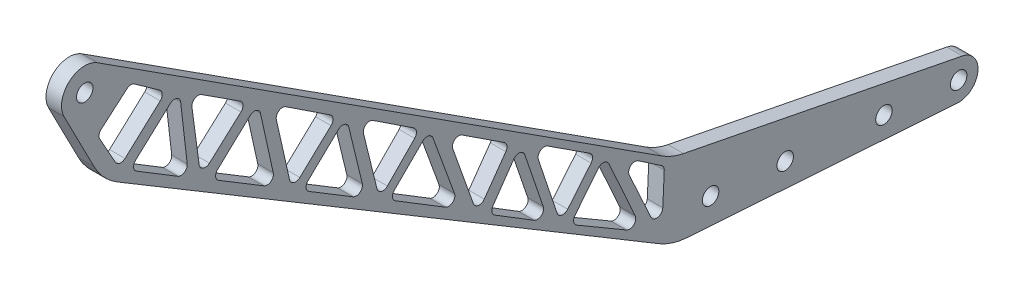
from build123d import *

# Parameters (mm, degrees)
SKETCH1_R           = 3.3782
BOSS_EXTRUDE1_DEPTH = 3.175
FILLET1_R           = 25.4
CUT_EXTRUDE3_DEPTH  = 1228.011230878


with BuildPart() as part:
    # Sketch1 → Boss-Extrude1 (new, symmetric)
    with BuildSketch(Plane(origin=(-76.913317281, 0, 0), x_dir=(0, 0, -1), z_dir=(1, 0, 0))):
        with BuildLine():
            Line((535.218804975, 907.961983625), (418.2911251, 916.04381761))
            Line((418.2911251, 916.04381761), (184.951401043, 1055.750632131))
            Line((184.951401043, 1055.750632131), (169.332572934, 1086.068584812))
            ThreePointArc((169.332572934, 1086.068584812), (171.394960666, 1097.480629658), (182.951934738, 1098.442170633))
            Line((182.951934738, 1098.442170633), (418.2911251, 947.10209485))
            Line((418.2911251, 947.10209485), (537.29962452, 923.668549005))
            ThreePointArc((537.29962452, 923.668549005), (543.634872549, 914.838132707), (535.218804975, 907.961983625))
        make_face()
        with Locations((177.8, 1090.430729224)):
            Circle(SKETCH1_R, mode=Mode.SUBTRACT)
        with Locations((434.1661251, 925.56881761)):
            Circle(SKETCH1_R, mode=Mode.SUBTRACT)
        with Locations((535.7661251, 915.880591264)):
            Circle(SKETCH1_R, mode=Mode.SUBTRACT)
        with Locations((464.714426144, 922.655836753)):
            Circle(SKETCH1_R, mode=Mode.SUBTRACT)
        with Locations((505.170909535, 918.798045727)):
            Circle(SKETCH1_R, mode=Mode.SUBTRACT)
    extrude(amount=BOSS_EXTRUDE1_DEPTH, both=True)

    # Fillet1
    fillet1_edges = [part.edges().sort_by_distance(p)[0] for p in [
        (-76.913317281, 1055.750632131, -184.951401043),
        (-76.913317281, 947.10209485, -418.2911251),
        (-76.913317281, 916.04381761, -418.2911251),
    ]]
    fillet(fillet1_edges, radius=FILLET1_R)

    # Sketch2 → Cut-Extrude3 (cut, through all)
    with BuildSketch(Plane(origin=(-73.738317281, 0, 0), x_dir=(0, 0, -1), z_dir=(1, 0, 0))):
        with BuildLine():
            Line((212.829527262, 1069.041008654), (198.606049634, 1055.993377244))
            ThreePointArc((198.606049634, 1055.993377244), (197.795300031, 1053.872622167), (199.004269659, 1051.950823673))
            Line((199.004269659, 1051.950823673), (215.926269112, 1041.670444047))
            ThreePointArc((215.926269112, 1041.670444047), (218.615766996, 1041.702840334), (219.768239325, 1044.133119314))
            Line((219.768239325, 1044.133119314), (217.069717501, 1067.461130351))
            ThreePointArc((217.069717501, 1067.461130351), (215.433378305, 1069.549408202), (212.829527262, 1069.041008654))
        make_face()
        with BuildLine():
            Line((221.707673579, 1063.343418403), (224.650059998, 1041.397601628))
            ThreePointArc((224.650059998, 1041.397601628), (226.295455268, 1039.349533682), (228.873798055, 1039.853573743))
            Line((228.873798055, 1039.853573743), (241.787421721, 1051.564110485))
            ThreePointArc((241.787421721, 1051.564110485), (242.612688612, 1053.652910015), (241.458691259, 1055.579679079))
            Line((241.458691259, 1055.579679079), (225.602681174, 1065.814959112))
            ThreePointArc((225.602681174, 1065.814959112), (222.864267326, 1065.825618016), (221.707673579, 1063.343418403))
        make_face()
        with BuildLine():
            Line((249.760451588, 1047.10749846), (255.013087704, 1023.356955829))
            ThreePointArc((255.013087704, 1023.356955829), (254.013265485, 1020.744378563), (251.218034235, 1020.635352414))
            Line((251.218034235, 1020.635352414), (232.626725119, 1031.885207079))
            ThreePointArc((232.626725119, 1031.885207079), (231.415536776, 1033.793616649), (232.204814978, 1035.911645028))
            Line((232.204814978, 1035.911645028), (245.543487979, 1048.412332994))
            ThreePointArc((245.543487979, 1048.412332994), (248.031197276, 1048.985502953), (249.760451588, 1047.10749846))
        make_face()
        with BuildLine():
            Line((256.288700965, 1041.549552348), (261.699227336, 1017.532223082))
            ThreePointArc((261.699227336, 1017.532223082), (263.433970562, 1015.661584361), (265.918441333, 1016.241263821))
            Line((265.918441333, 1016.241263821), (278.68191244, 1028.260261394))
            ThreePointArc((278.68191244, 1028.260261394), (279.471228845, 1030.327426074), (278.340023722, 1032.229152966))
            Line((278.340023722, 1032.229152966), (260.166026244, 1044.227484659))
            ThreePointArc((260.166026244, 1044.227484659), (257.323131811, 1044.197737851), (256.288700965, 1041.549552348))
        make_face()
        with BuildLine():
            Line((285.950762569, 1024.127747845), (291.489074391, 1001.273962422))
            ThreePointArc((291.489074391, 1001.273962422), (290.521120532, 998.626397343), (287.704860772, 998.503042243))
            Line((287.704860772, 998.503042243), (269.68827306, 1009.412873607))
            ThreePointArc((269.68827306, 1009.412873607), (268.479155554, 1011.307952053), (269.247601949, 1013.420480774))
            Line((269.247601949, 1013.420480774), (281.725877839, 1025.364434832))
            ThreePointArc((281.725877839, 1025.364434832), (284.195768621, 1025.967239758), (285.950762569, 1024.127747845))
        make_face()
        with BuildLine():
            Line((291.987661771, 1018.793447787), (297.503537578, 996.444310029))
            ThreePointArc((297.503537578, 996.444310029), (299.299237091, 994.60297465), (301.782224152, 995.273666815))
            Line((301.782224152, 995.273666815), (312.933934335, 1006.634819154))
            ThreePointArc((312.933934335, 1006.634819154), (313.6470155, 1008.682638254), (312.519272923, 1010.53473018))
            Line((312.519272923, 1010.53473018), (295.851686933, 1021.522715599))
            ThreePointArc((295.851686933, 1021.522715599), (292.988274637, 1021.476732768), (291.987661771, 1018.793447787))
        make_face()
        with BuildLine():
            Line((320.43174526, 1003.042647499), (329.235265326, 978.936149714))
            ThreePointArc((329.235265326, 978.936149714), (328.4584938, 976.099552316), (325.524390369, 975.89782016))
            Line((325.524390369, 975.89782016), (305.073021534, 988.402510218))
            ThreePointArc((305.073021534, 988.402510218), (303.875475207, 990.272233251), (304.605525107, 992.36913777))
            Line((304.605525107, 992.36913777), (316.253373877, 1003.970945497))
            ThreePointArc((316.253373877, 1003.970945497), (318.596738762, 1004.650885005), (320.43174526, 1003.042647499))
        make_face()
        with BuildLine():
            Line((328.561260154, 995.121856848), (337.000941843, 971.414023738))
            ThreePointArc((337.000941843, 971.414023738), (339.045281299, 969.749894674), (341.465034537, 970.795573217))
            Line((341.465034537, 970.795573217), (350.288338122, 983.224922615))
            ThreePointArc((350.288338122, 983.224922615), (350.712684232, 985.168376168), (349.606394049, 986.821616429))
            Line((349.606394049, 986.821616429), (332.343408774, 998.100100142))
            ThreePointArc((332.343408774, 998.100100142), (329.382755058, 997.969265202), (328.561260154, 995.121856848))
        make_face()
        with BuildLine():
            Line((358.024430372, 978.322536498), (365.613309751, 956.067392739))
            ThreePointArc((365.613309751, 956.067392739), (364.794906144, 953.263366281), (361.87942795, 953.083544871))
            Line((361.87942795, 953.083544871), (345.738253845, 963.002192697))
            ThreePointArc((345.738253845, 963.002192697), (344.582183675, 964.644722243), (344.980616731, 966.613389976))
            Line((344.980616731, 966.613389976), (353.532911458, 978.949885909))
            ThreePointArc((353.532911458, 978.949885909), (355.971718879, 980.018341425), (358.024430372, 978.322536498))
        make_face()
        with BuildLine():
            Line((363.615874983, 973.721063502), (371.268981922, 950.928748763))
            ThreePointArc((371.268981922, 950.928748763), (373.213443941, 949.239891979), (375.634371673, 950.118685866))
            Line((375.634371673, 950.118685866), (385.228376127, 961.721691253))
            ThreePointArc((385.228376127, 961.721691253), (385.781511629, 963.725345148), (384.653290598, 965.471112922))
            Line((384.653290598, 965.471112922), (367.406179205, 976.660422274))
            ThreePointArc((367.406179205, 976.660422274), (364.467208793, 976.536746973), (363.615874983, 973.721063502))
        make_face()
        with BuildLine():
            Line((388.186069656, 958.41994865), (378.599867016, 946.444586396))
            ThreePointArc((378.599867016, 946.444586396), (378.08528434, 944.394624911), (379.299998005, 942.664998323))
            Line((379.299998005, 942.664998323), (399.676592476, 930.741691599))
            ThreePointArc((399.676592476, 930.741691599), (402.658414673, 931.045858516), (403.274364745, 933.979181996))
            Line((403.274364745, 933.979181996), (392.483972914, 957.877850974))
            ThreePointArc((392.483972914, 957.877850974), (390.486852417, 959.352659847), (388.186069656, 958.41994865))
        make_face()
        with BuildLine():
            Line((400.820115867, 949.685591668), (409.728953388, 930.245258202))
            ThreePointArc((409.728953388, 930.245258202), (412.521388617, 928.809846), (414.575258558, 931.18465567))
            Line((414.575258558, 931.18465567), (415.183462879, 944.176707725))
            ThreePointArc((415.183462879, 944.176707725), (414.917392366, 945.432794043), (414.07098559, 946.398269018))
            Line((414.07098559, 946.398269018), (404.553943748, 952.846550429))
            ThreePointArc((404.553943748, 952.846550429), (401.488032641, 952.682365719), (400.820115867, 949.685591668))
        make_face()
        with BuildLine():
            Line((208.711450484, 1072.015171488), (194.287916409, 1058.802239081))
            ThreePointArc((194.287916409, 1058.802239081), (192.16892136, 1058.167385906), (190.355779754, 1059.434546548))
            Line((190.355779754, 1059.434546548), (183.964187217, 1070.853297625))
            ThreePointArc((183.964187217, 1070.853297625), (183.678957074, 1072.533712718), (184.520211939, 1074.016089651))
            Line((184.520211939, 1074.016089651), (195.064693985, 1083.124475769))
            ThreePointArc((195.064693985, 1083.124475769), (196.606217233, 1083.739524101), (198.198488111, 1083.271280763))
            Line((198.198488111, 1083.271280763), (208.469132676, 1075.957075975))
            ThreePointArc((208.469132676, 1075.957075975), (209.530934135, 1074.043947163), (208.711450484, 1072.015171488))
        make_face()
    extrude(amount=-CUT_EXTRUDE3_DEPTH, mode=Mode.SUBTRACT)


solid = part.part
